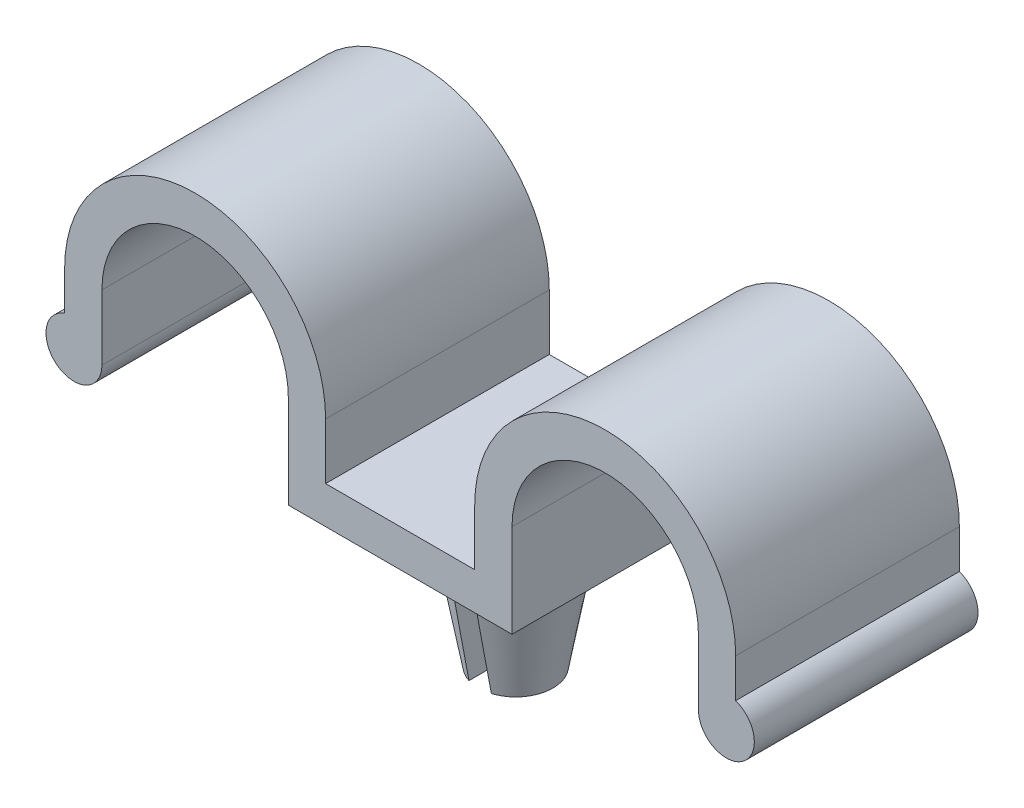
from build123d import *

# Parameters (mm, degrees)
BASE_EXTRUDE_DEPTH      = 3.81
CUT_EXTRUDE1_DEPTH      = 21.962310846
CUT_EXTRUDE1_DEPTH_BACK = 21.962310846


with BuildPart() as part:
    # Sketch1 → Base-Extrude (new, symmetric)
    with BuildSketch(Plane.XY):
        with BuildLine():
            Line((-9.525, -1.905), (-4.445, -1.905))
            Line((-4.445, -1.905), (-4.445, 0))
            ThreePointArc((-4.445, 0), (0, 4.445), (4.445, 0))
            Line((4.445, 0), (4.445, -1.324474388))
            ThreePointArc((4.445, -1.324474388), (4.677426131, -3.000212993), (3.175, -2.2225))
            Line((3.175, -2.2225), (3.175, 0))
            ThreePointArc((3.175, 0), (0, 3.175), (-3.175, 0))
            Line((-3.175, 0), (-3.175, -3.175))
            Line((-3.175, -3.175), (-10.795, -3.175))
            Line((-10.795, -3.175), (-10.795, 0))
            ThreePointArc((-10.795, 0), (-13.97, 3.175), (-17.145, 0))
            Line((-17.145, 0), (-17.145, -2.2225))
            ThreePointArc((-17.145, -2.2225), (-18.647426131, -3.000212993), (-18.415, -1.324474388))
            Line((-18.415, -1.324474388), (-18.415, 0))
            ThreePointArc((-18.415, 0), (-13.97, 4.445), (-9.525, 0))
            Line((-9.525, 0), (-9.525, -1.905))
        make_face()
    extrude(amount=BASE_EXTRUDE_DEPTH, both=True)

    # Sketch4 → Boss-Revolve1 (revolve)
    with BuildSketch(Plane.XY):
        Polygon((-6.858, -3.175), (-6.858, -7.874), (-5.588, -7.874), (-5.08, -5.08), (-5.08, -4.826), (-5.334, -4.826), (-5.334, -3.175), align=None)
    revolve(axis=Axis((-6.858, -3.175, 0), (0, 1, 0)))

    # Sketch5 → Cut-Extrude1 (cut, two sides: drawn at the far end of the back side and taken through both)
    with BuildSketch(Plane.XY.offset(-CUT_EXTRUDE1_DEPTH_BACK)):
        with BuildLine():
            Line((-7.239, -7.874), (-6.477, -7.874))
            Line((-6.477, -7.874), (-6.477, -3.81))
            ThreePointArc((-6.477, -3.81), (-6.858, -3.429), (-7.239, -3.81))
            Line((-7.239, -3.81), (-7.239, -7.874))
        make_face()
    extrude(amount=CUT_EXTRUDE1_DEPTH + CUT_EXTRUDE1_DEPTH_BACK, mode=Mode.SUBTRACT)


solid = part.part
